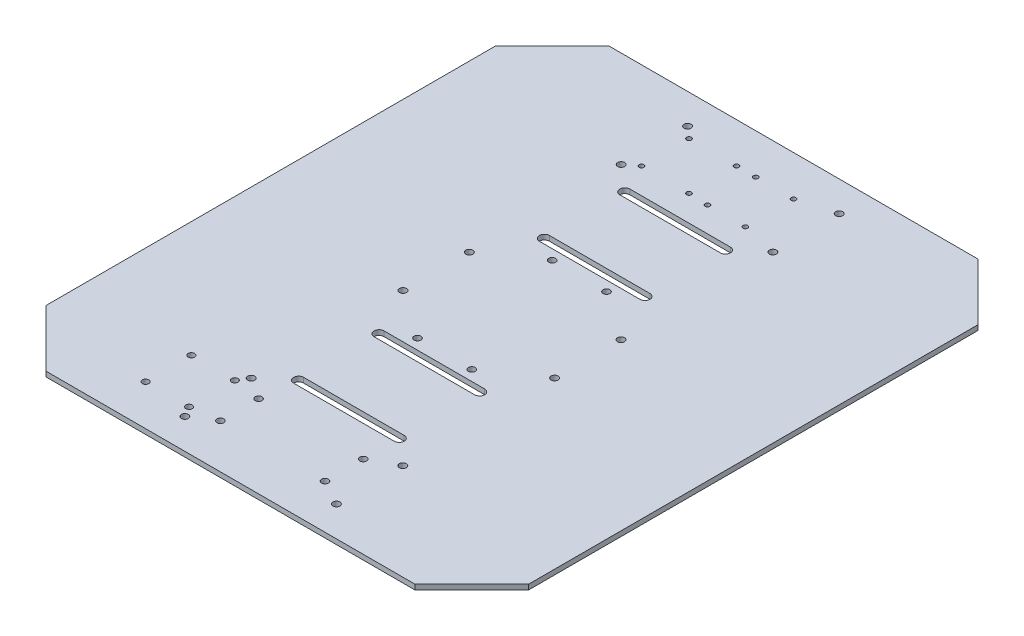
from build123d import *

# Parameters (mm, degrees)
SKETCH1_R               = 2.2225
BOSS_EXTRUDE1_DEPTH     = 3.175
SKETCH2_R               = 2.159
CUT_EXTRUDE1_DEPTH      = 297.247830215
CUT_EXTRUDE2_DEPTH      = 297.247830215
SKETCH7_R               = 1.524
CUT_EXTRUDE3_DEPTH      = 297.247830215
CUT_EXTRUDE4_DEPTH      = 297.247830215
CUT_EXTRUDE4_DEPTH_BACK = 297.247830215
SKETCH8_R               = 1.524
SKETCH9_R               = 2.032
CUT_EXTRUDE5_DEPTH      = 297.247830215
SKETCH10_R              = 2.159
CUT_EXTRUDE6_DEPTH      = 297.247830215


with BuildPart() as part:
    # Sketch1 → Boss-Extrude1 (new body)
    with BuildSketch(Plane(origin=(0, 0, 0), x_dir=(1, 0, 0), z_dir=(0, 1, 0))):
        Polygon((-85.365028143, 123.058976948), (-121.286052627, 87.137952464), (-121.286052627, -196.619998567), (-85.365028143, -232.541023052), (147.592922888, -232.541023052), (183.513947373, -196.619998567), (183.513947373, 87.137952464), (147.592922888, 123.058976948), align=None)
        with Locations((-16.765052627, -213.491023052)):
            Circle(SKETCH1_R, mode=Mode.SUBTRACT)
        with Locations((-16.765052627, -171.581023052)):
            Circle(SKETCH1_R, mode=Mode.SUBTRACT)
        with Locations((-16.765052627, -75.696023052)):
            Circle(SKETCH1_R, mode=Mode.SUBTRACT)
        with Locations((78.992947373, -213.491023052)):
            Circle(SKETCH1_R, mode=Mode.SUBTRACT)
        with Locations((78.992947373, -171.581023052)):
            Circle(SKETCH1_R, mode=Mode.SUBTRACT)
        with Locations((78.992947373, -75.696023052)):
            Circle(SKETCH1_R, mode=Mode.SUBTRACT)
        with Locations((-16.765052627, -33.786023052)):
            Circle(SKETCH1_R, mode=Mode.SUBTRACT)
        with Locations((-16.765052627, 62.098976948)):
            Circle(SKETCH1_R, mode=Mode.SUBTRACT)
        with Locations((-16.765052627, 104.008976948)):
            Circle(SKETCH1_R, mode=Mode.SUBTRACT)
        with Locations((78.992947373, -33.786023052)):
            Circle(SKETCH1_R, mode=Mode.SUBTRACT)
        with Locations((78.992947373, 62.098976948)):
            Circle(SKETCH1_R, mode=Mode.SUBTRACT)
        with Locations((78.992947373, 104.008976948)):
            Circle(SKETCH1_R, mode=Mode.SUBTRACT)
    extrude(amount=BOSS_EXTRUDE1_DEPTH)

    # Sketch2 → Cut-Extrude1 (cut, through all)
    with BuildSketch(Plane(origin=(0, 3.175, 0), x_dir=(1, 0, 0), z_dir=(0, 1, 0))):
        with Locations((13.841947373, -12.069023052)):
            Circle(SKETCH2_R)
        with Locations((48.131947373, -12.069023052)):
            Circle(SKETCH2_R)
        with Locations((13.841947373, -97.159023052)):
            Circle(SKETCH2_R)
        with Locations((48.131947373, -97.159023052)):
            Circle(SKETCH2_R)
    extrude(amount=-CUT_EXTRUDE1_DEPTH, mode=Mode.SUBTRACT)

    # Sketch4 → Cut-Extrude2 (cut, through all)
    with BuildSketch(Plane(origin=(0, 3.175, 0), x_dir=(1, 0, 0), z_dir=(0, 1, 0))):
        with BuildLine():
            Line((-0.636052627, 51.430976948), (62.863947373, 51.430976948))
            ThreePointArc((62.863947373, 51.430976948), (66.038947373, 48.255976948), (62.863947373, 45.080976948))
            Line((62.863947373, 45.080976948), (-0.636052627, 45.080976948))
            ThreePointArc((-0.636052627, 45.080976948), (-3.811052627, 48.255976948), (-0.636052627, 51.430976948))
        make_face()
        with BuildLine():
            Line((-0.636052627, 0.630976948), (62.863947373, 0.630976948))
            ThreePointArc((62.863947373, 0.630976948), (66.038947373, -2.544023052), (62.863947373, -5.719023052))
            Line((62.863947373, -5.719023052), (-0.636052627, -5.719023052))
            ThreePointArc((-0.636052627, -5.719023052), (-3.811052627, -2.544023052), (-0.636052627, 0.630976948))
        make_face()
        with BuildLine():
            Line((-0.636052627, -110.113023052), (62.863947373, -110.113023052))
            ThreePointArc((62.863947373, -110.113023052), (66.038947373, -106.938023052), (62.863947373, -103.763023052))
            Line((62.863947373, -103.763023052), (-0.636052627, -103.763023052))
            ThreePointArc((-0.636052627, -103.763023052), (-3.811052627, -106.938023052), (-0.636052627, -110.113023052))
        make_face()
        with BuildLine():
            Line((-0.636052627, -160.913023052), (62.863947373, -160.913023052))
            ThreePointArc((62.863947373, -160.913023052), (66.038947373, -157.738023052), (62.863947373, -154.563023052))
            Line((62.863947373, -154.563023052), (-0.636052627, -154.563023052))
            ThreePointArc((-0.636052627, -154.563023052), (-3.811052627, -157.738023052), (-0.636052627, -160.913023052))
        make_face()
    extrude(amount=-CUT_EXTRUDE2_DEPTH, mode=Mode.SUBTRACT)

    # Sketch7 → Cut-Extrude3 (cut, through all)
    with BuildSketch(Plane(origin=(0, 3.175, 0), x_dir=(1, 0, 0), z_dir=(0, 1, 0))):
        with Locations((-9.526052627, 67.686976948)):
            Circle(SKETCH7_R)
        with Locations((20.445947373, 67.686976948)):
            Circle(SKETCH7_R)
        with Locations((-9.526052627, 97.658976948)):
            Circle(SKETCH7_R)
        with Locations((20.445947373, 97.658976948)):
            Circle(SKETCH7_R)
    extrude(amount=-CUT_EXTRUDE3_DEPTH, mode=Mode.SUBTRACT)

    # Sketch8 → Cut-Extrude4 (cut, two sides: drawn at the far end of the back side and taken through both)
    with BuildSketch(Plane(origin=(0, 3.175, 0), x_dir=(1, 0, 0), z_dir=(0, 1, 0)).offset(-CUT_EXTRUDE4_DEPTH_BACK)):
        with Locations((32.637947373, 67.178976948)):
            Circle(SKETCH8_R)
        with Locations((32.637947373, 97.658976948)):
            Circle(SKETCH8_R)
        with Locations((56.513947373, 67.178976948)):
            Circle(SKETCH8_R)
        with Locations((56.513947373, 97.658976948)):
            Circle(SKETCH8_R)
    extrude(amount=CUT_EXTRUDE4_DEPTH + CUT_EXTRUDE4_DEPTH_BACK, mode=Mode.SUBTRACT)

    # Sketch9 → Cut-Extrude5 (cut, through all)
    with BuildSketch(Plane(origin=(0, 0, 0), x_dir=(-1, 0, 0), z_dir=(0, -1, 0))):
        with Locations((48.134052627, -206.887023052)):
            Circle(SKETCH9_R)
        with Locations((20.702052627, -206.887023052)):
            Circle(SKETCH9_R)
        with Locations((48.134052627, -177.931023052)):
            Circle(SKETCH9_R)
        with Locations((20.702052627, -177.931023052)):
            Circle(SKETCH9_R)
    extrude(amount=-CUT_EXTRUDE5_DEPTH, mode=Mode.SUBTRACT)

    # Sketch10 → Cut-Extrude6 (cut, through all)
    with BuildSketch(Plane.XZ):
        with Locations((-3.176052627, 204.601023052)):
            Circle(SKETCH10_R)
        with Locations((62.863947373, 204.601023052)):
            Circle(SKETCH10_R)
        with Locations((-3.176052627, 180.471023052)):
            Circle(SKETCH10_R)
        with Locations((62.863947373, 180.471023052)):
            Circle(SKETCH10_R)
    extrude(amount=-CUT_EXTRUDE6_DEPTH, mode=Mode.SUBTRACT)


solid = part.part
